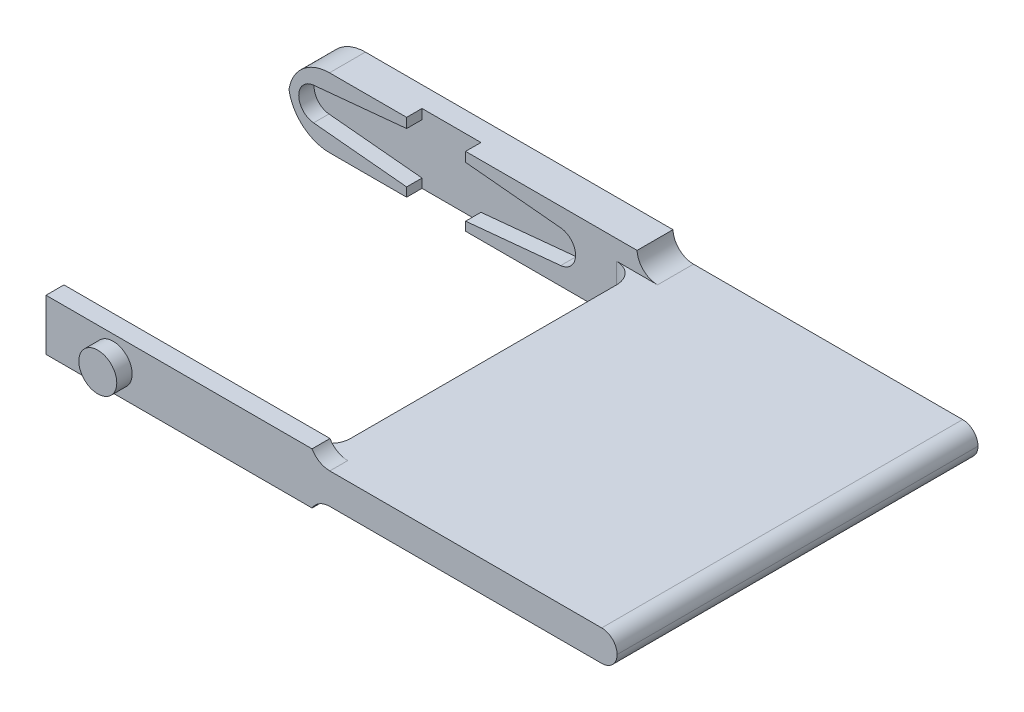
from build123d import *

# Parameters (mm, degrees)
SKETCH1_W            = 29
SKETCH1_H            = 6.75
BOSS_EXTRUDE10_DEPTH = 3.5
SKETCH1_16_R         = 0.291434634
BOSS_EXTRUDE15_DEPTH = 2
SKETCH1_17_W         = 29.75
SKETCH1_17_H         = 3
BOSS_EXTRUDE17_DEPTH = 35.2
SKETCH1_18_W         = 5
SKETCH1_18_H         = 1.912928139
SKETCH1_18_H_2       = 3
SKETCH1_18_H_3       = 1.837071861
BOSS_EXTRUDE20_DEPTH = 3.5
SKETCH2_W            = 25.95
SKETCH2_H            = 5
BOSS_EXTRUDE18_DEPTH = 1.75
FILLET1_R            = 2
FILLET3_R            = 2
FILLET2_R            = 4
SKETCH3_W            = 5.75
SKETCH3_H            = 1.125
CUT_EXTRUDE1_DEPTH   = 1.5
SKETCH4_R            = 1.85
BOSS_EXTRUDE19_DEPTH = 1.5
FILLET4_R            = 1.5


# Some blends are built 0.0001 mm under size
with BuildPart() as part:
    # Sketch1 → Boss-Extrude10 (new body)
    with BuildSketch(Plane.XY):
        with Locations((0, 3.375)):
            Rectangle(SKETCH1_W, SKETCH1_H)
        with BuildLine():
            Line((-12.052929028, 4.929746565), (0, 6.087071861))
            Line((0, 6.087071861), (12.052929028, 4.929746565))
            ThreePointArc((12.052929028, 4.929746565), (13.5, 3.337071861), (12.052929028, 1.744397157))
            Line((12.052929028, 1.744397157), (0, 0.587071861))
            Line((0, 0.587071861), (-12.052929028, 1.744397157))
            ThreePointArc((-12.052929028, 1.744397157), (-13.5, 3.337071861), (-12.052929028, 4.929746565))
        make_face(mode=Mode.SUBTRACT)
    extrude(amount=BOSS_EXTRUDE10_DEPTH)

    # Sketch1<16> → Boss-Extrude15 (add)
    # profile 1 of 9: a face of its own
    with BuildSketch(Plane.XY):
        with BuildLine():
            Line((-0.523286746, 6.036825735), (-12.052929028, 4.929746565))
            ThreePointArc((-12.052929028, 4.929746565), (-13.5, 3.337071861), (-12.052929028, 1.744397157))
            Line((-12.052929028, 1.744397157), (-0.523286746, 0.637317987))
            ThreePointArc((-0.523286746, 0.637317987), (-2.75, 3.337071861), (-0.523286746, 6.036825735))
        make_face()
        with Locations((-11.9, 3.337071861)):
            Circle(SKETCH1_16_R, mode=Mode.SUBTRACT)
        with Locations((-9.863185408, 3.337071861)):
            Circle(SKETCH1_16_R, mode=Mode.SUBTRACT)
        with Locations((-7.826370816, 3.337071861)):
            Circle(SKETCH1_16_R, mode=Mode.SUBTRACT)
    # profile 2 of 9: a face of its own
    with BuildSketch(Plane.XY):
        with Locations((-11.9, 3.337071861)):
            Circle(SKETCH1_16_R)
    # profile 3 of 9: a face of its own
    with BuildSketch(Plane.XY):
        with Locations((-7.826370816, 3.337071861)):
            Circle(SKETCH1_16_R)
    # profile 4 of 9: a face of its own
    with BuildSketch(Plane.XY):
        with Locations((-9.863185408, 3.337071861)):
            Circle(SKETCH1_16_R)
    # profile 5 of 9: a face of its own
    with BuildSketch(Plane.XY):
        with BuildLine():
            Line((0, 6.087071861), (-0.523286746, 6.036825735))
            ThreePointArc((-0.523286746, 6.036825735), (-2.75, 3.337071861), (-0.523286746, 0.637317987))
            Line((-0.523286746, 0.637317987), (0, 0.587071861))
            Line((0, 0.587071861), (0.523286746, 0.637317987))
            ThreePointArc((0.523286746, 0.637317987), (2.121501656, 1.587291668), (2.75, 3.337071861))
            ThreePointArc((2.75, 3.337071861), (2.121501656, 5.086852054), (0.523286746, 6.036825735))
            Line((0.523286746, 6.036825735), (0, 6.087071861))
        make_face()
    # profile 6 of 9: a face of its own
    with BuildSketch(Plane.XY):
        with BuildLine():
            Line((12.052929028, 4.929746565), (0.523286746, 6.036825735))
            ThreePointArc((0.523286746, 6.036825735), (2.121501656, 5.086852054), (2.75, 3.337071861))
            ThreePointArc((2.75, 3.337071861), (2.121501656, 1.587291668), (0.523286746, 0.637317987))
            Line((0.523286746, 0.637317987), (12.052929028, 1.744397157))
            ThreePointArc((12.052929028, 1.744397157), (13.5, 3.337071861), (12.052929028, 4.929746565))
        make_face()
        with Locations((7.826370816, 3.337071861)):
            Circle(SKETCH1_16_R, mode=Mode.SUBTRACT)
        with Locations((9.863185408, 3.337071861)):
            Circle(SKETCH1_16_R, mode=Mode.SUBTRACT)
        with Locations((11.9, 3.337071861)):
            Circle(SKETCH1_16_R, mode=Mode.SUBTRACT)
    # profile 7 of 9: a face of its own
    with BuildSketch(Plane.XY):
        with Locations((11.9, 3.337071861)):
            Circle(SKETCH1_16_R)
    # profile 8 of 9: a face of its own
    with BuildSketch(Plane.XY):
        with Locations((9.863185408, 3.337071861)):
            Circle(SKETCH1_16_R)
    # profile 9 of 9: a face of its own
    with BuildSketch(Plane.XY):
        with Locations((7.826370816, 3.337071861)):
            Circle(SKETCH1_16_R)
    extrude(amount=BOSS_EXTRUDE15_DEPTH)



with BuildPart() as body_2:
    # Sketch1<17> → Boss-Extrude17 (new body)
    with BuildSketch(Plane.XY):
        with Locations((34.375, 3.337071861)):
            Rectangle(SKETCH1_17_W, SKETCH1_17_H)
    extrude(amount=BOSS_EXTRUDE17_DEPTH)


with BuildPart() as part_1:
    add(part.part)

    add(body_2.part)  # Boss-Extrude20 merges body 2
    # Sketch1<18> → Boss-Extrude20 (add)
    with BuildSketch(Plane.XY):
        with Locations((17, 5.793535931)):
            Rectangle(SKETCH1_18_W, SKETCH1_18_H)
        with Locations((17, 3.337071861)):
            Rectangle(SKETCH1_18_W, SKETCH1_18_H_2)
        with Locations((17, 0.918535931)):
            Rectangle(SKETCH1_18_W, SKETCH1_18_H_3)
    extrude(amount=BOSS_EXTRUDE20_DEPTH)

    # Sketch2 → Boss-Extrude18 (add)
    with BuildSketch(Plane.XY.offset(35.2)):
        with Locations((6.525, 3.337071861)):
            Rectangle(SKETCH2_W, SKETCH2_H)
    extrude(amount=-BOSS_EXTRUDE18_DEPTH)

    # Fillet1
    # the kernel refuses this fillet: 2 mm, written as the material it adds along each edge
    with BuildSketch(Plane(origin=(19.5, 4.837071861, 33.45), x_dir=(1, 0, 0), z_dir=(0, 0, 1))) as fillet1_piece_1:
        with BuildLine():
            CenterArc((1.732050808, 2), FILLET1_R, 210, 60)
            Line((0, 1), (0, 0))
            Line((0, 0), (1.732050808, 0))
        make_face()
    extrude(amount=1.75)
    with BuildSketch(Plane(origin=(19.5, 4.837071861, 0), x_dir=(0, 1, 0), z_dir=(0, 0, 1))) as fillet1_piece_2:
        with BuildLine():
            CenterArc((2, -1.998103724), FILLET1_R, 92.495213733, 87.504786267)
            Line((0, -1.998103724), (0, 0))
            Line((0, 0), (1.912928139, 0))
        make_face()
    extrude(amount=3.5)
    with BuildSketch(Plane(origin=(19.5, 1.837071861, 33.45), x_dir=(1, 0, 0), z_dir=(0, 0, 1))) as fillet1_piece_3:
        with BuildLine():
            CenterArc((1.732050808, -2), FILLET1_R, 90, 60)
            Line((0, -1), (0, 0))
            Line((0, 0), (1.732050808, 0))
        make_face()
    extrude(amount=1.75)
    with BuildSketch(Plane(origin=(19.5, 1.837071861, 0), x_dir=(0, -1, 0), z_dir=(0, 0, 1))) as fillet1_piece_4:
        with BuildLine():
            CenterArc((2, 1.993352558), FILLET1_R, 180, 85.327274549)
            Line((0, 1.993352558), (0, 0))
            Line((0, 0), (1.837071861, 0))
        make_face()
    extrude(amount=3.5)

    # Fillet3
    fillet3_edges = [part_1.edges().sort_by_distance(p)[0] for p in [
        (19.5, 3.337071861, 3.5),
        (19.5, 3.337071861, 33.45),
    ]]
    fillet(fillet3_edges, radius=FILLET3_R)

    # Fillet2
    # the kernel refuses this fillet: 4 mm, written as the material it takes off along each edge
    with BuildSketch(Plane(origin=(-14.5, 6.75, -10), x_dir=(1, 0, 0), z_dir=(0, 0, 1)), Plane(origin=(-14.5, 0, -10), x_dir=(0, 1, 0), z_dir=(0, 0, 1))) as fillet2_piece_1:
        with BuildLine():
            CenterArc((FILLET2_R, -FILLET2_R), FILLET2_R, 90, 90)
            Line((0, -FILLET2_R), (0, 0))
            Line((0, 0), (FILLET2_R, 0))
        make_face()
    extrude(amount=23.5, mode=Mode.SUBTRACT)

    # Sketch3 → Cut-Extrude1 (cut)
    with BuildSketch(Plane.XY.offset(3.5)):
        with Locations((-0.102107464, 6.1875)):
            Rectangle(SKETCH3_W, SKETCH3_H)
        with Locations((-0.102107464, 0.5625)):
            Rectangle(SKETCH3_W, SKETCH3_H)
    extrude(amount=-CUT_EXTRUDE1_DEPTH, mode=Mode.SUBTRACT)

    # Sketch4 → Boss-Extrude19 (add)
    with BuildSketch(Plane.XY.offset(35.2)):
        with Locations((0.102107464, 3.375)):
            Circle(SKETCH4_R)
    extrude(amount=BOSS_EXTRUDE19_DEPTH)

    # Fillet4
    fillet4_edges = [part_1.edges().sort_by_distance(p)[0] for p in [
        (49.25, 4.837071861, 17.6),
        (49.25, 1.837071861, 17.6),
    ]]
    fillet(fillet4_edges, radius=FILLET4_R - 0.0001)  # a hair under: the kernel refuses the full size


solid = part_1.part
